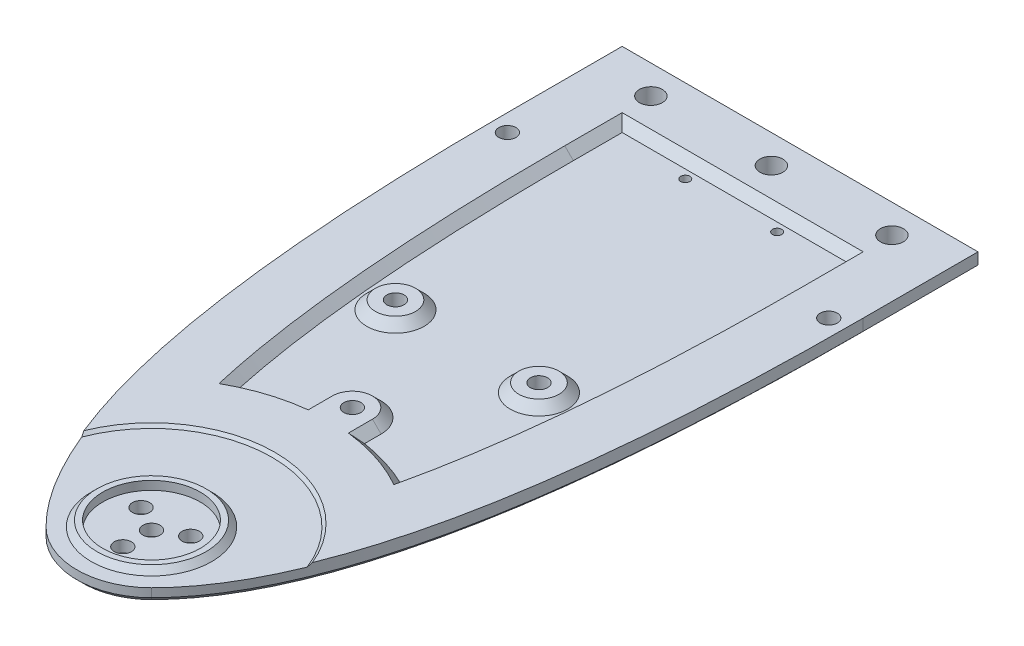
from build123d import *

# Parameters (mm, degrees)
EXTRUDE_1_OUTLINE_R     = 8.5
EXTRUDE_1_OUTLINE_R_2   = 2
EXTRUDE_1_DEPTH         = 3
SKETCH_2_5_R            = 8.5
SKETCH_2_5_R_2          = 1.5
EXTRUDE_3_DEPTH         = 2
CUT_EXTRUDE_START       = -3
CUT_EXTRUDE_1_OUTLINE_R = 1.5
CUT_EXTRUDE_1_DEPTH     = 3
SKETCH_14_R             = 21
SKETCH_14_R_2           = 11
CUT_EXTRUDE_2_DEPTH     = 0.5
SKETCH_15_R             = 9.5
SKETCH_15_R_2           = 8.5
EXTRUDE_4_DEPTH         = 0.5
SKETCH_15_3_R           = 11
SKETCH_15_3_R_2         = 9.5
CUT_EXTRUDE_3_DEPTH     = 0.5
SKETCH_17_R             = 3.5
CUT_EXTRUDE_4_DEPTH     = 1.5
HOLE_WIZARD_M2_1_D      = 1.6
CHAMFER_1_SIZE          = 0.5
CHAMFER_2_SIZE          = 1
CHAMFER_3_SIZE          = 1
CHAMFER_4_SIZE          = 1.5


# Read off the part's stored shape, not the designer's step: 凸台-拉伸1, 切除-拉伸1
with BuildPart() as part:
    # 凸台-拉伸1 outline → 凸台-拉伸1 (new body)
    with BuildSketch(Plane(origin=(0, 0, 0), x_dir=(1, 0, 0), z_dir=(0, 1, 0))):
        with BuildLine():
            add(Edge.make_bspline(
                [(-17.166812063, -88.021637563), (-38.974423907, -66.214025718), (-38.974423907, 14.170750592)],
                knots=[0, 0, 0, 1, 1, 1], degree=2))
            ThreePointArc((-17.166812063, -88.021637563), (-7.974423908, -91.829249408), (1.217964248, -88.021637563))
            add(Edge.make_bspline(
                [(1.217964248, -88.021637563), (23.025576093, -66.214025718), (23.025576093, 14.170750592)],
                knots=[0, 0, 0, 1, 1, 1], degree=2))
            Line((23.025576093, 14.170750592), (23.025576093, 34.170750592))
            Line((23.025576093, 34.170750592), (-38.974423907, 34.170750592))
            Line((-38.974423907, 34.170750592), (-38.974423907, 14.170750592))
        make_face()
        with Locations((-7.974423907, -78.829249408)):
            Circle(EXTRUDE_1_OUTLINE_R, mode=Mode.SUBTRACT)
        with Locations((-28.974423907, 29.170750592)):
            Circle(EXTRUDE_1_OUTLINE_R_2, mode=Mode.SUBTRACT)
        with Locations((-7.974423907, 29.170750592)):
            Circle(EXTRUDE_1_OUTLINE_R_2, mode=Mode.SUBTRACT)
        with Locations((13.025576093, 29.170750592)):
            Circle(EXTRUDE_1_OUTLINE_R_2, mode=Mode.SUBTRACT)
    extrude(amount=EXTRUDE_1_DEPTH)

    # 草图2<5> → 凸台-拉伸3 (add)
    with BuildSketch(Plane(origin=(0, 0, 0), x_dir=(1, 0, 0), z_dir=(0, 1, 0))):
        with Locations(Location((-7.974423907, -78.829249408, 0), (0, 0, 270))):
            Circle(SKETCH_2_5_R)
        with Locations(Location((-7.974423907, -78.829249408, 0), (0, 0, 270))):
            Circle(SKETCH_2_5_R_2, mode=Mode.SUBTRACT)
        with Locations(Location((-7.974423907, -83.829249408, 0), (0, 0, 270))):
            Circle(SKETCH_2_5_R_2, mode=Mode.SUBTRACT)
        with Locations(Location((-12.304550926, -76.329249408, 0), (0, 0, 270))):
            Circle(SKETCH_2_5_R_2, mode=Mode.SUBTRACT)
        with Locations(Location((-3.644296889, -76.329249408, 0), (0, 0, 270))):
            Circle(SKETCH_2_5_R_2, mode=Mode.SUBTRACT)
    extrude(amount=EXTRUDE_3_DEPTH)

    # 切除-拉伸1 outline → 切除-拉伸1 (cut)
    with BuildSketch(Plane(origin=(0, 3, 0), x_dir=(1, 0, 0), z_dir=(0, 1, 0)).offset(CUT_EXTRUDE_START)):
        with Locations((-20.474423907, -23.829249408)):
            Circle(CUT_EXTRUDE_1_OUTLINE_R)
        with Locations((-7.974423907, -43.829249408)):
            Circle(CUT_EXTRUDE_1_OUTLINE_R)
        with Locations((4.525576093, -23.829249408)):
            Circle(CUT_EXTRUDE_1_OUTLINE_R)
        with Locations((-35.966826399, 11.170789443)):
            Circle(CUT_EXTRUDE_1_OUTLINE_R)
        with BuildLine():
            ThreePointArc((20.028398358, 12.670753252), (20.021777301, 12.670755407), (20.015156318, 12.670786788))
            ThreePointArc((20.015156318, 12.670786788), (20.014179778, 9.670794253), (20.028398358, 12.670753252))
        make_face()
    extrude(amount=CUT_EXTRUDE_1_DEPTH, mode=Mode.SUBTRACT)

    # 草图14 → 切除-拉伸2 (cut)
    with BuildSketch(Plane(origin=(0, 3, 0), x_dir=(1, 0, 0), z_dir=(0, 1, 0))):
        with Locations((-7.974423907, -78.829249408)):
            Circle(SKETCH_14_R)
        with Locations(Location((-7.974423907, -78.829249408, 0), (0, 0, 270))):
            Circle(SKETCH_14_R_2, mode=Mode.SUBTRACT)
    extrude(amount=-CUT_EXTRUDE_2_DEPTH, mode=Mode.SUBTRACT)

    # 草图15 → 凸台-拉伸4 (add)
    with BuildSketch(Plane(origin=(0, 3, 0), x_dir=(1, 0, 0), z_dir=(0, 1, 0))):
        with Locations(Location((-7.974423907, -78.829249408, 0), (0, 0, 270))):
            Circle(SKETCH_15_R)
        with Locations(Location((-7.974423907, -78.829249408, 0), (0, 0, 270))):
            Circle(SKETCH_15_R_2, mode=Mode.SUBTRACT)
    extrude(amount=EXTRUDE_4_DEPTH)

    # 草图15<3> → 切除-拉伸3 (cut)
    with BuildSketch(Plane(origin=(0, 3, 0), x_dir=(1, 0, 0), z_dir=(0, 1, 0))):
        with Locations((-7.974423907, -78.829249408)):
            Circle(SKETCH_15_3_R)
        with Locations(Location((-7.974423907, -78.829249408, 0), (0, 0, 270))):
            Circle(SKETCH_15_3_R_2, mode=Mode.SUBTRACT)
    extrude(amount=-CUT_EXTRUDE_3_DEPTH, mode=Mode.SUBTRACT)

    # 草图17 → 切除-拉伸4 (cut)
    with BuildSketch(Plane(origin=(0, 3, 0), x_dir=(1, 0, 0), z_dir=(0, 1, 0))):
        with BuildLine():
            Line((13.025576092, 14.170750422), (13.025576093, 24.170750592))
            Line((13.025576093, 24.170750592), (-28.974423907, 24.170750592))
            Line((-28.974423907, 24.170750592), (-28.974423907, 14.170750592))
            add(Edge.make_bspline(
                [(-28.974423907, 14.170750592), (-28.974423907, 13.311861342), (-28.970577127, 11.586194366), (-28.947516149, 8.198019857), (-28.889914894, 4.037728889), (-28.774892402, -0.820742579), (-28.560545128, -7.124589729), (-28.178715271, -14.674765284), (-27.540114076, -23.204861593), (-26.723596489, -31.200556861), (-25.89763435, -37.41453686), (-25.151910121, -42.11313709), (-24.550677966, -45.500866022), (-24.016057668, -48.206887938), (-23.56719588, -50.307521536), (-23.33835214, -51.325314161), (-23.220255995, -51.837313496)],
                knots=[0.495235673, 0.495235673, 0.495235673, 0.495235673, 0.495300523, 0.495365373, 0.495495073, 0.495624773, 0.495754473, 0.496013874, 0.496273274, 0.496532675, 0.496792075, 0.496921775, 0.497051475, 0.497181176, 0.497246026, 0.497310876, 0.497310876, 0.497310876, 0.497310876], degree=3))
            ThreePointArc((-23.220255995, -51.837313496), (-17.53895703, -49.341629884), (-11.474423907, -48.027463761))
            Line((-11.474423907, -48.027463761), (-11.474423907, -43.829249408))
            ThreePointArc((-11.474423907, -43.829249408), (-7.974423907, -40.329249408), (-4.474423907, -43.829249408))
            Line((-4.474423907, -43.829249408), (-4.474423907, -48.027463766))
            ThreePointArc((-4.474423907, -48.027463766), (1.590109217, -49.341629893), (7.271408173, -51.837313525))
            add(Edge.make_bspline(
                [(7.271408173, -51.837313525), (7.389504318, -51.325314191), (7.618348058, -50.307521568), (8.067209846, -48.206887974), (8.601830143, -45.500866064), (9.203062298, -42.113137138), (9.948786527, -37.414536918), (10.774748665, -31.200556932), (11.591266253, -23.20486168), (12.22986745, -14.674765389), (12.611697308, -7.124589851), (12.826044583, -0.820742715), (12.941067076, 4.037728742), (12.998668332, 8.198019701), (13.021729311, 11.586194202), (13.025576092, 13.311861174), (13.025576092, 14.170750422)],
                knots=[0.502689124, 0.502689124, 0.502689124, 0.502689124, 0.502753974, 0.502818824, 0.502948525, 0.503078225, 0.503207925, 0.503467325, 0.503726726, 0.503986126, 0.504245527, 0.504375227, 0.504504927, 0.504634627, 0.504699477, 0.504764327, 0.504764327, 0.504764327, 0.504764327], degree=3))
        make_face()
        with Locations(Location((-20.474423907, -23.829249408, 0), (0, 0, 270))):
            Circle(SKETCH_17_R, mode=Mode.SUBTRACT)
        with Locations(Location((4.525576093, -23.829249408, 0), (0, 0, 270))):
            Circle(SKETCH_17_R, mode=Mode.SUBTRACT)
    extrude(amount=-CUT_EXTRUDE_4_DEPTH, mode=Mode.SUBTRACT)

    # M2 螺纹孔1 (through all)
    with Locations(Plane(origin=(-14.974423907, 0, -21.170750592), x_dir=(0, 0, -1), z_dir=(0, -1, 0))):
        with Locations((0, 0), (0, 16)):
            Hole(HOLE_WIZARD_M2_1_D / 2)

    # 倒角1
    chamfer_1_edges = [part.edges().sort_by_distance(p)[0] for p in [
        (-7.974423907, 3, 57.829249408),
    ]]
    chamfer(chamfer_1_edges, length=CHAMFER_1_SIZE - 0.0001)  # a hair under: the kernel refuses the full size

    # 倒角2
    chamfer_2_edges = [part.edges().sort_by_distance(p)[0] for p in [
        (-38.974423907, 0, -24.170750592),
        (23.025576093, 0, -24.170750592),
        (-7.974423907, 0, 91.829249408),
    ]]
    chamfer(chamfer_2_edges, length=CHAMFER_2_SIZE)

    # 倒角3
    chamfer_3_edges = [part.edges().sort_by_distance(p)[0] for p in [
        (-7.974423907, 2.5, 69.329249408),
    ]]
    chamfer(chamfer_3_edges, length=CHAMFER_3_SIZE - 0.0001)  # a hair under: the kernel refuses the full size

    # 倒角4
    chamfer_4_edges = [part.edges().sort_by_distance(p)[0] for p in [
        (1.590109217, 1.5, 49.341629893),
    ]]
    chamfer(chamfer_4_edges, length=CHAMFER_4_SIZE - 0.0001)  # a hair under: the kernel refuses the full size
    chamfer_4_2_edges = [part.edges().sort_by_distance(p)[0] for p in [
        (-4.474423907, 1.5, 45.173805289),
        (-7.974423907, 1.5, 40.329249408),
        (-11.474423907, 1.5, 45.928356584),
    ]]
    chamfer(chamfer_4_2_edges, length=CHAMFER_4_SIZE - 0.0001)  # a hair under: the kernel refuses the full size
    chamfer_4_3_edges = [part.edges().sort_by_distance(p)[0] for p in [
        (-18.256270706, 1.5, 49.584016882),
    ]]
    chamfer(chamfer_4_3_edges, length=CHAMFER_4_SIZE - 0.0001)  # a hair under: the kernel refuses the full size
    chamfer_4_4_edges = [part.edges().sort_by_distance(p)[0] for p in [
        (-27.599295062, 1.5, 22.087266062),
        (-28.974423907, 1.5, -19.170750592),
    ]]
    chamfer(chamfer_4_4_edges, length=CHAMFER_4_SIZE - 0.0001)  # a hair under: the kernel refuses the full size
    chamfer_4_5_edges = [part.edges().sort_by_distance(p)[0] for p in [
        (-7.224473907, 1.5, -24.170750592),
    ]]
    chamfer(chamfer_4_5_edges, length=CHAMFER_4_SIZE - 0.0001)  # a hair under: the kernel refuses the full size
    chamfer_4_6_edges = [part.edges().sort_by_distance(p)[0] for p in [
        (13.025576092, 1.5, -18.420800507),
        (11.65044724, 1.5, 22.087266148),
    ]]
    chamfer(chamfer_4_6_edges, length=CHAMFER_4_SIZE - 0.0001)  # a hair under: the kernel refuses the full size
    chamfer_4_7_edges = [part.edges().sort_by_distance(p)[0] for p in [
        (-20.474423907, 1.5, 20.329249408),
    ]]
    chamfer(chamfer_4_7_edges, length=CHAMFER_4_SIZE - 0.0001)  # a hair under: the kernel refuses the full size
    chamfer_4_8_edges = [part.edges().sort_by_distance(p)[0] for p in [
        (4.525576093, 1.5, 20.329249408),
    ]]
    chamfer(chamfer_4_8_edges, length=CHAMFER_4_SIZE - 0.0001)  # a hair under: the kernel refuses the full size


solid = part.part
